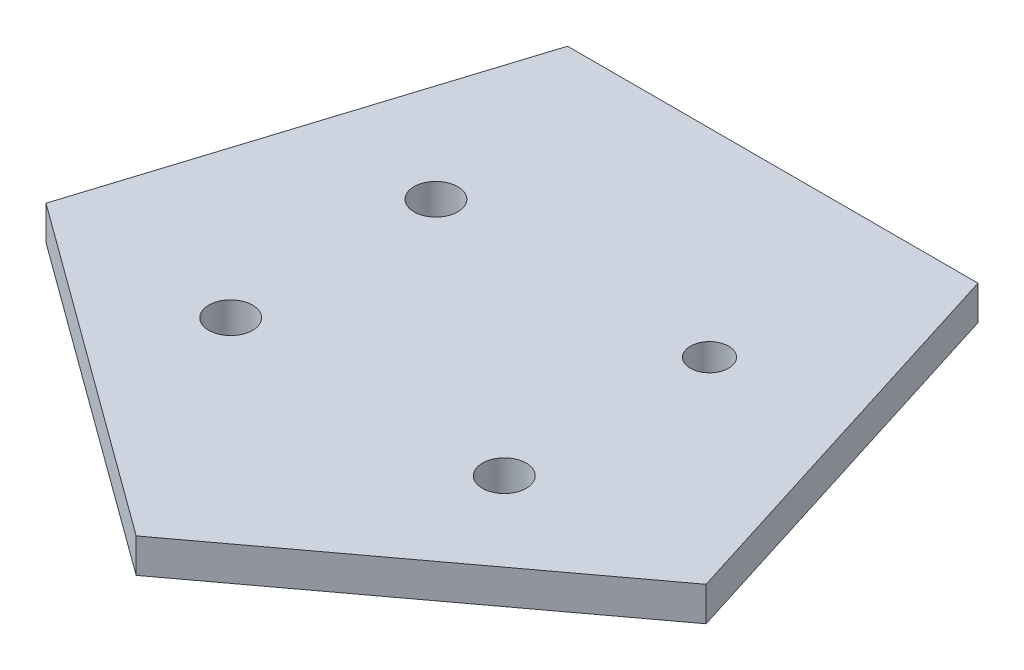
from build123d import *

# Parameters (mm, degrees)
BOSS_EXTRUDE1_DEPTH = 1.5875
SKETCH2_R           = 1.778
SKETCH2_R_2         = 2.032
CUT_EXTRUDE1_DEPTH  = 78.500788069


with BuildPart() as part:
    # Sketch1 → Boss-Extrude1 (new, symmetric)
    with BuildSketch(Plane(origin=(0, 0, 0), x_dir=(1, 0, 0), z_dir=(0, 1, 0))):
        Polygon((0, 0), (-11.58875, -36.83), (19.343746859, -59.391242197), (49.68875, -36.83), (38.1, 0), align=None)
    extrude(amount=BOSS_EXTRUDE1_DEPTH, both=True)

    # Sketch2 → Cut-Extrude1 (cut, through all)
    with BuildSketch(Plane(origin=(0, 1.5875, 0), x_dir=(1, 0, 0), z_dir=(0, 1, 0))):
        with Locations((31.59125, -18.415)):
            Circle(SKETCH2_R)
        with Locations((6.19125, -18.415)):
            Circle(SKETCH2_R_2)
        with Locations((6.19125, -37.465)):
            Circle(SKETCH2_R_2)
        with Locations((31.59125, -37.465)):
            Circle(SKETCH2_R_2)
    extrude(amount=-CUT_EXTRUDE1_DEPTH, mode=Mode.SUBTRACT)


solid = part.part
